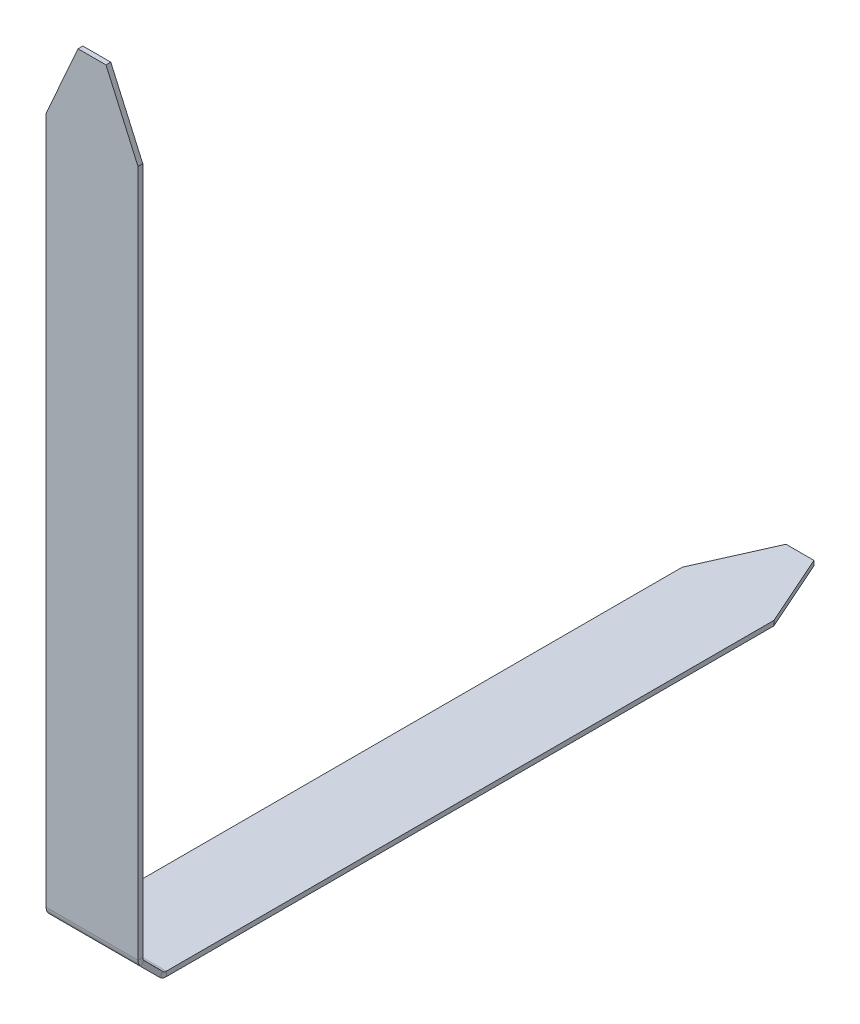
from build123d import *
from OCP.BRepFilletAPI import BRepFilletAPI_MakeChamfer

# Parameters (mm, degrees)
SM_BASE_FLANGE_1_DEPTH = 115
CHAMFER_1_SIZE         = 90
CHAMFER_1_SIZE2        = 40
CHAMFER_2_SIZE         = 40
CHAMFER_2_SIZE2        = 90


# Sheet-metal steps are written as plain solids
with BuildPart() as part:
    # Sketch 1 → 基体-法兰1 (new body)
    with BuildSketch(Plane(origin=(0, 0, 0), x_dir=(0, 0, -1), z_dir=(1, 0, 0))):
        with BuildLine():
            Line((0, 980), (0, 29.485281374))
            ThreePointArc((0, 29.485281374), (0.456722805, 27.18918078), (1.757359313, 25.242640687))
            Line((1.757359313, 25.242640687), (25.242640687, 1.757359313))
            ThreePointArc((25.242640687, 1.757359313), (27.18918078, 0.456722805), (29.485281374, 0))
            Line((29.485281374, 0), (880, 0))
            Line((880, 0), (880, -6))
            Line((880, -6), (29.485281374, -6))
            ThreePointArc((29.485281374, -6), (24.893080186, -5.08655439), (21, -2.485281374))
            Line((21, -2.485281374), (-2.485281374, 21))
            ThreePointArc((-2.485281374, 21), (-5.08655439, 24.893080186), (-6, 29.485281374))
            Line((-6, 29.485281374), (-6, 980))
            Line((-6, 980), (0, 980))
        make_face()
    extrude(amount=SM_BASE_FLANGE_1_DEPTH)

    # 倒角1
    chamfer_1_edges = [part.edges().sort_by_distance(p)[0] for p in [
        (115, 980, 3),
        (115, -3, -880),
    ]]
    chamfer_1_side = [part.faces().sort_by_distance(p)[0] for p in [
        (115, 25.400361972, 3.861867822),
    ]]
    chamfer(chamfer_1_edges, length=CHAMFER_1_SIZE, length2=CHAMFER_1_SIZE2, reference=chamfer_1_side[0])

    # 倒角2: one chamfer whose edges measure the first distance from different faces: ONE call of the kernel's chamfer builder (chamfer() names one face for all edges)
    chamfer_2_edges_1 = [part.edges().sort_by_distance(p)[0] for p in [
        (0, 980, 3),
    ]]
    chamfer_2_side_1 = [part.faces().sort_by_distance(p)[0] for p in [
        (37.5, 980, 3),
    ]]
    chamfer_2_edges_2 = [part.edges().sort_by_distance(p)[0] for p in [
        (0, -3, -880),
    ]]
    chamfer_2_side_2 = [part.faces().sort_by_distance(p)[0] for p in [
        (37.5, -3, -880),
    ]]
    chamfer_2 = BRepFilletAPI_MakeChamfer(part.part.solid().wrapped)
    for e in chamfer_2_edges_1:
        chamfer_2.Add(CHAMFER_2_SIZE, CHAMFER_2_SIZE2, e.wrapped, chamfer_2_side_1[0].wrapped)  # the first distance lies on this face
    for e in chamfer_2_edges_2:
        chamfer_2.Add(CHAMFER_2_SIZE, CHAMFER_2_SIZE2, e.wrapped, chamfer_2_side_2[0].wrapped)  # the first distance lies on this face
    add(Compound.cast(chamfer_2.Shape()), mode=Mode.REPLACE)


solid = part.part
